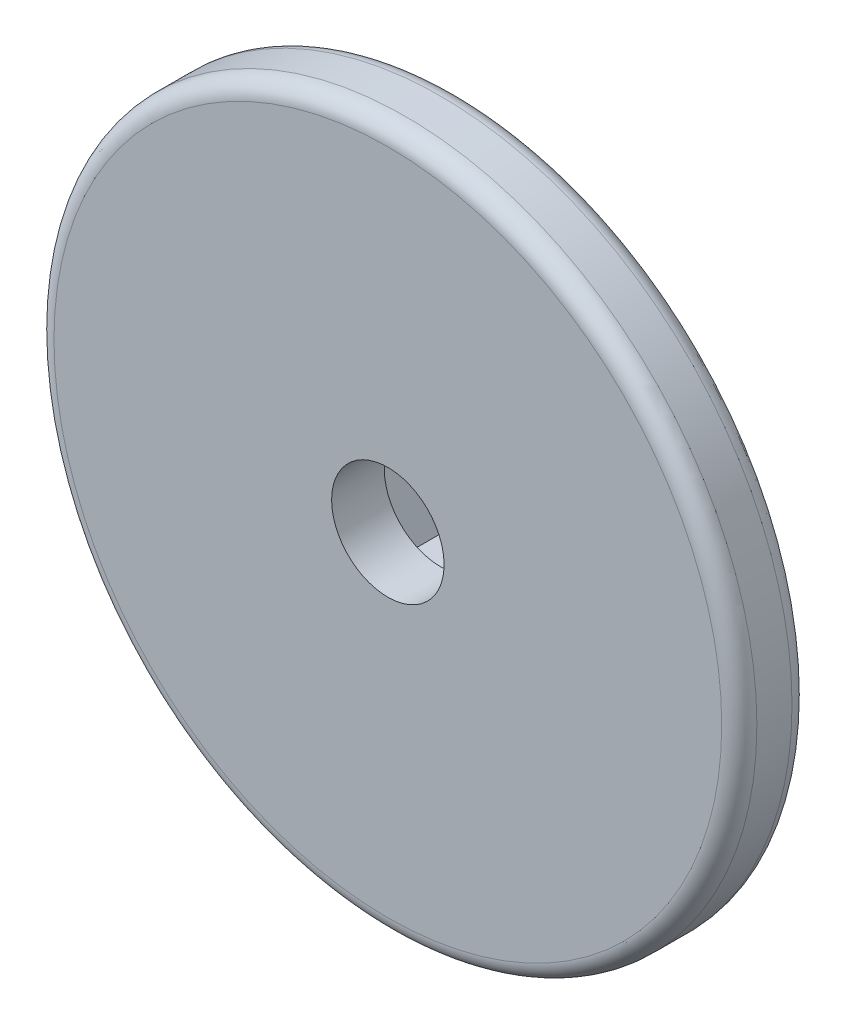
from build123d import *

# Parameters (mm, degrees)
SKETCH2_R          = 1.6
CUT_EXTRUDE1_DEPTH = 15.568802353
CUT_EXTRUDE2_DEPTH = 2


with BuildPart() as part:
    # Sketch1 → Revolve1 (revolve)
    with BuildSketch(Plane(origin=(0, 0, 0), x_dir=(1, 0, 0), z_dir=(0, 1, 0))):
        with BuildLine():
            Line((0, 0), (9.5, 0))
            ThreePointArc((9.5, 0), (9.853553391, 0.146446609), (10, 0.5))
            Line((10, 0.5), (10, 1.5))
            ThreePointArc((10, 1.5), (9.853553391, 1.853553391), (9.5, 2))
            Line((9.5, 2), (7, 2))
            Line((7, 2), (6.192982456, 4))
            Line((6.192982456, 4), (4.692982456, 4))
            Line((4.692982456, 4), (4.035087719, 3.5))
            Line((4.035087719, 3.5), (0, 3.5))
            Line((0, 3.5), (0, 0))
        make_face()
    revolve(axis=Axis((0, 0, -3.5), (0, 0, 1)))

    # Sketch2 → Cut-Extrude1 (cut, through all)
    with BuildSketch(Plane(origin=(0, 0, -3.5), x_dir=(-1, 0, 0), z_dir=(0, 0, -1))):
        Circle(SKETCH2_R)
    extrude(amount=-CUT_EXTRUDE1_DEPTH, mode=Mode.SUBTRACT)

    # Sketch3 → Cut-Extrude2 (cut)
    with BuildSketch(Plane(origin=(0, 0, -3.5), x_dir=(-1, 0, 0), z_dir=(0, 0, -1))):
        Polygon((-1.293380551, -2.6773121), (1.671930017, -2.458756464), (2.965310568, 0.218555636), (1.293380551, 2.6773121), (-1.671930017, 2.458756464), (-2.965310568, -0.218555636), align=None)
    extrude(amount=-CUT_EXTRUDE2_DEPTH, mode=Mode.SUBTRACT)


solid = part.part
